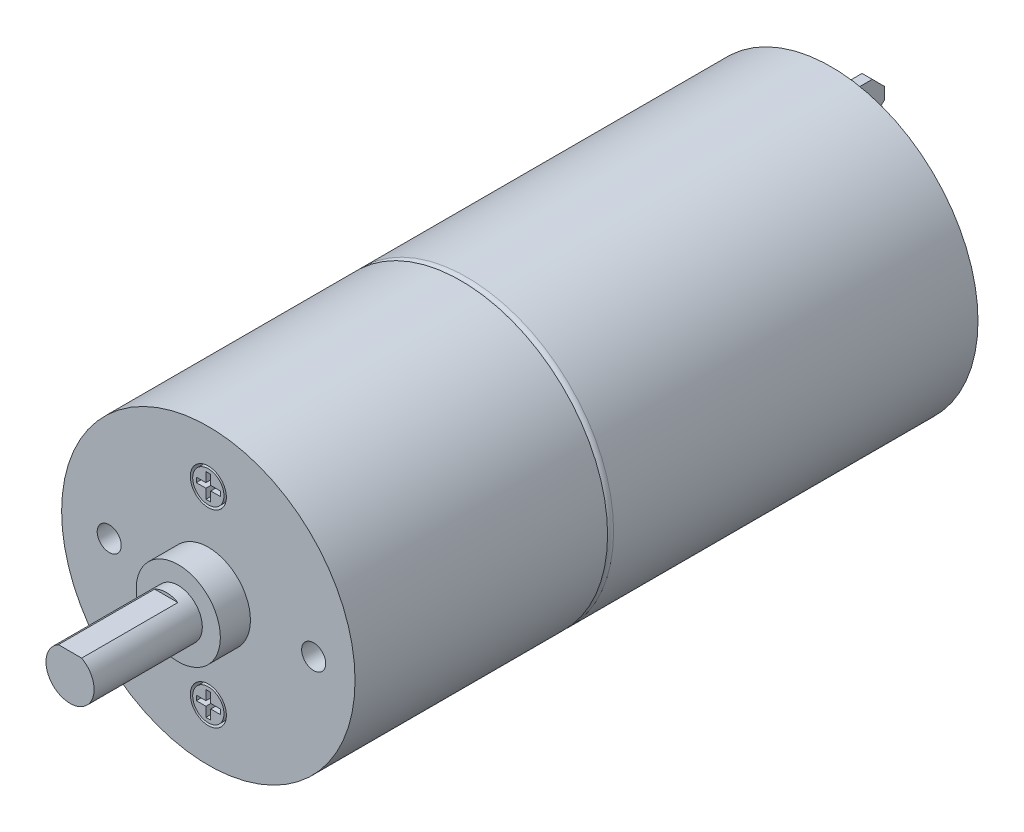
from build123d import *

# Parameters (mm, degrees)
IZIM1_R                     = 12.2
Y_KSEKLIK_EKSTR_ZYON1_DEPTH = 30.8
RADYUS1_R                   = 0.5
IZIM2_R                     = 12.2
Y_KSEKLIK_EKSTR_ZYON2_DEPTH = 21
IZIM3_R                     = 3.5
Y_KSEKLIK_EKSTR_ZYON3_DEPTH = 2.5
IZIM4_R                     = 2
Y_KSEKLIK_EKSTR_ZYON4_DEPTH = 9
IZIM5_R                     = 1
KES_EKSTR_ZYON1_DEPTH       = 10
IZIM6_R                     = 1.5
IZIM6_R_2                   = 1.3
KES_EKSTR_ZYON2_DEPTH       = 1
KES_EKSTR_ZYON3_START       = -8
KES_EKSTR_ZYON3_DEPTH       = 8
IZIM9_R                     = 3.25
Y_KSEKLIK_EKSTR_ZYON5_DEPTH = 1
IZIM10_R                    = 0.75
Y_KSEKLIK_EKSTR_ZYON6_DEPTH = 5
IZIM11_W                    = 0.852537123
IZIM11_H                    = 3
Y_KSEKLIK_EKSTR_ZYON7_DEPTH = 4
IZIM12_R                    = 0.75
KES_EKSTR_ZYON4_DEPTH       = 4
PAH1_SIZE                   = 1


with BuildPart() as part:
    # Çizim1 → Yükseklik-Ekstrüzyon1 (new body)
    with BuildSketch(Plane.XY):
        with Locations((-41.143471688, 10.161406423)):
            Circle(IZIM1_R)
    extrude(amount=Y_KSEKLIK_EKSTR_ZYON1_DEPTH)

    # Radyus1
    radyus1_edges = [part.edges().sort_by_distance(p)[0] for p in [
        (-53.343471688, 10.161406423, 30.8),
    ]]
    fillet(radyus1_edges, radius=RADYUS1_R)

    # Çizim2 → Yükseklik-Ekstrüzyon2 (add)
    with BuildSketch(Plane.XY.offset(30.8)):
        with Locations((-41.143471688, 10.161406423)):
            Circle(IZIM2_R)
    extrude(amount=Y_KSEKLIK_EKSTR_ZYON2_DEPTH)

    # Çizim3 → Yükseklik-Ekstrüzyon3 (add)
    with BuildSketch(Plane.XY.offset(51.8)):
        with Locations((-41.143471688, 10.161406423)):
            Circle(IZIM3_R)
    extrude(amount=Y_KSEKLIK_EKSTR_ZYON3_DEPTH)

    # Çizim4 → Yükseklik-Ekstrüzyon4 (add)
    with BuildSketch(Plane.XY.offset(54.3)):
        with Locations((-41.143471688, 10.161406423)):
            Circle(IZIM4_R)
    extrude(amount=Y_KSEKLIK_EKSTR_ZYON4_DEPTH)

    # Çizim5 → Kes-Ekstrüzyon1 (cut)
    with BuildSketch(Plane.XY.offset(51.8)):
        with Locations((-49.384663885, 10.161406423)):
            Circle(IZIM5_R)
        with Locations((-32.384663885, 10.161406423)):
            Circle(IZIM5_R)
    extrude(amount=-KES_EKSTR_ZYON1_DEPTH, mode=Mode.SUBTRACT)

    # Çizim6 → Kes-Ekstrüzyon2 (cut)
    # profile 1 of 4: a face of its own
    with BuildSketch(Plane.XY.offset(51.8)):
        with Locations((-41.143471688, 2.311406423)):
            Circle(IZIM6_R)
        with Locations((-41.143471688, 2.311406423)):
            Circle(IZIM6_R_2, mode=Mode.SUBTRACT)
    # profile 2 of 4: a face of its own
    with BuildSketch(Plane.XY.offset(51.8)):
        Polygon((-40.943471688, 3.311406423), (-41.343471688, 3.311406423), (-41.343471688, 2.511406423), (-42.143471688, 2.511406423), (-42.143471688, 2.111406423), (-41.343471688, 2.111406423), (-41.343471688, 1.311406423), (-40.943471688, 1.311406423), (-40.943471688, 2.111406423), (-40.143471688, 2.111406423), (-40.143471688, 2.511406423), (-40.943471688, 2.511406423), align=None)
    # profile 3 of 4: a face of its own
    with BuildSketch(Plane.XY.offset(51.8)):
        with Locations((-41.143471688, 18.011406423)):
            Circle(IZIM6_R)
        with Locations((-41.143471688, 18.011406423)):
            Circle(IZIM6_R_2, mode=Mode.SUBTRACT)
    # profile 4 of 4: a face of its own
    with BuildSketch(Plane.XY.offset(51.8)):
        Polygon((-41.343471688, 17.011406423), (-40.943471688, 17.011406423), (-40.943471688, 17.811406423), (-40.143471688, 17.811406423), (-40.143471688, 18.211406423), (-40.943471688, 18.211406423), (-40.943471688, 19.011406423), (-41.343471688, 19.011406423), (-41.343471688, 18.211406423), (-42.143471688, 18.211406423), (-42.143471688, 17.811406423), (-41.343471688, 17.811406423), align=None)
    extrude(amount=-KES_EKSTR_ZYON2_DEPTH, mode=Mode.SUBTRACT)

    # Çizim8 → Kes-Ekstrüzyon3 (cut)
    with BuildSketch(Plane.XY.offset(63.3).offset(KES_EKSTR_ZYON3_START)):
        with BuildLine():
            Line((-42.111717524, 11.911406423), (-40.175225851, 11.911406423))
            ThreePointArc((-40.175225851, 11.911406423), (-41.143471688, 12.161406423), (-42.111717524, 11.911406423))
        make_face()
    extrude(amount=KES_EKSTR_ZYON3_DEPTH, mode=Mode.SUBTRACT)

    # Çizim9 → Yükseklik-Ekstrüzyon5 (add)
    with BuildSketch(Plane(origin=(0, 0, 0), x_dir=(-1, 0, 0), z_dir=(0, 0, -1))):
        with Locations((41.143471688, 10.161406423)):
            Circle(IZIM9_R)
    extrude(amount=Y_KSEKLIK_EKSTR_ZYON5_DEPTH)

    # Çizim10 → Yükseklik-Ekstrüzyon6 (add)
    with BuildSketch(Plane(origin=(0, 0, -1), x_dir=(-1, 0, 0), z_dir=(0, 0, -1))):
        with Locations((41.143471688, 10.161406423)):
            Circle(IZIM10_R)
    extrude(amount=Y_KSEKLIK_EKSTR_ZYON6_DEPTH)

    # Çizim11 → Yükseklik-Ekstrüzyon7 (add)
    with BuildSketch(Plane(origin=(0, 0, 0), x_dir=(-1, 0, 0), z_dir=(0, 0, -1))):
        with Locations((41.159259413, 18.661406423)):
            Rectangle(IZIM11_W, IZIM11_H)
        with Locations((41.159259413, 1.661406423)):
            Rectangle(IZIM11_W, IZIM11_H)
    extrude(amount=Y_KSEKLIK_EKSTR_ZYON7_DEPTH)

    # Çizim12 → Kes-Ekstrüzyon4 (cut)
    with BuildSketch(Plane(origin=(-40.732990851, 0, 0), x_dir=(0, 0, -1), z_dir=(1, 0, 0))):
        with Locations((1.925401768, 18.661406423)):
            Circle(IZIM12_R)
        with Locations((1.925401768, 1.661406423)):
            Circle(IZIM12_R)
    extrude(amount=-KES_EKSTR_ZYON4_DEPTH, mode=Mode.SUBTRACT)

    # Pah1
    pah1_edges = [part.edges().sort_by_distance(p)[0] for p in [
        (-41.159259412, 0.161406423, -4),
        (-41.159259412, 3.161406423, -4),
        (-41.159259412, 20.161406423, -4),
        (-41.159259412, 17.161406423, -4),
    ]]
    chamfer(pah1_edges, length=PAH1_SIZE)


solid = part.part
